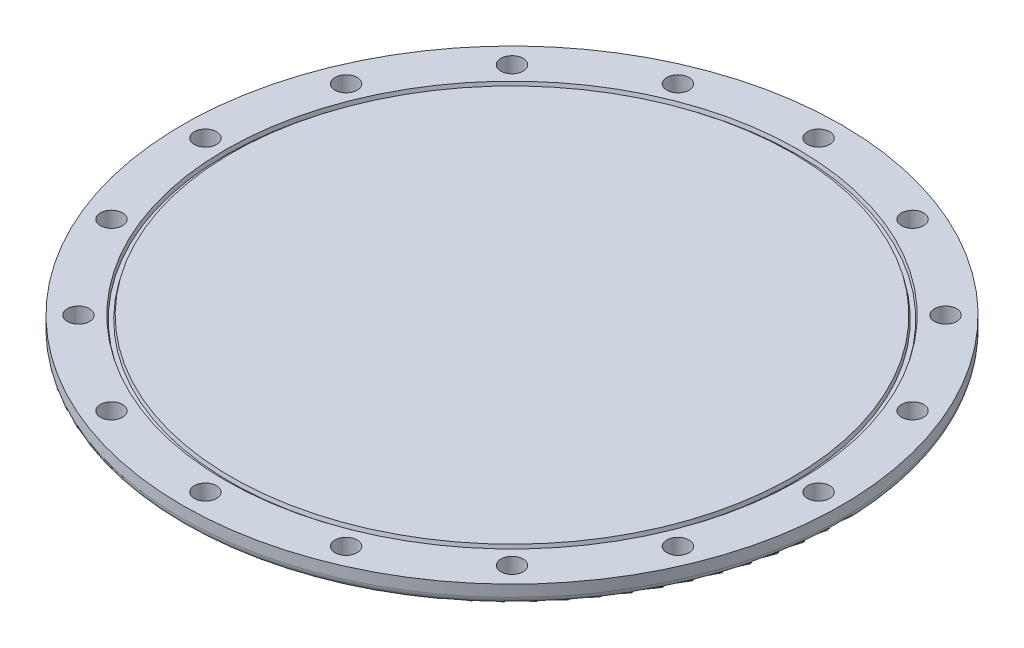
from build123d import *

# Parameters (mm, degrees)
SKETCH1_R           = 86
BOSS_EXTRUDE1_DEPTH = 5
CUT_EXTRUDE1_REACH  = 123.725
SKETCH2_R           = 2.9
FILLET1_R           = 2


with BuildPart() as part:
    # Sketch1 → Boss-Extrude1 (new body)
    with BuildSketch(Plane(origin=(0, 0, 0), x_dir=(1, 0, 0), z_dir=(0, 1, 0))):
        Circle(SKETCH1_R)
    extrude(amount=BOSS_EXTRUDE1_DEPTH)

    # Sketch2 → Cut-Extrude1 (cut, up to next)
    with BuildSketch(Plane(origin=(0, 5, 0), x_dir=(1, 0, 0), z_dir=(0, 1, 0)), mode=Mode.PRIVATE) as cut_extrude1_sk1:
        with Locations((0, 80)):
            Circle(SKETCH2_R)
    cut_extrude1_tool1 = extrude(cut_extrude1_sk1.sketch, amount=-CUT_EXTRUDE1_REACH, mode=Mode.PRIVATE) & part.part
    # Sketch2 → Cut-Extrude1 (cut, up to next)
    with BuildSketch(Plane(origin=(0, 5, 0), x_dir=(1, 0, 0), z_dir=(0, 1, 0)), mode=Mode.PRIVATE) as cut_extrude1_sk2:
        with Locations((30.614674589, 73.910362601)):
            Circle(SKETCH2_R)
    cut_extrude1_tool2 = extrude(cut_extrude1_sk2.sketch, amount=-CUT_EXTRUDE1_REACH, mode=Mode.PRIVATE) & part.part
    # Sketch2 → Cut-Extrude1 (cut, up to next)
    with BuildSketch(Plane(origin=(0, 5, 0), x_dir=(1, 0, 0), z_dir=(0, 1, 0)), mode=Mode.PRIVATE) as cut_extrude1_sk3:
        with Locations((56.568542495, 56.568542495)):
            Circle(SKETCH2_R)
    cut_extrude1_tool3 = extrude(cut_extrude1_sk3.sketch, amount=-CUT_EXTRUDE1_REACH, mode=Mode.PRIVATE) & part.part
    # Sketch2 → Cut-Extrude1 (cut, up to next)
    with BuildSketch(Plane(origin=(0, 5, 0), x_dir=(1, 0, 0), z_dir=(0, 1, 0)), mode=Mode.PRIVATE) as cut_extrude1_sk4:
        with Locations((73.910362601, 30.614674589)):
            Circle(SKETCH2_R)
    cut_extrude1_tool4 = extrude(cut_extrude1_sk4.sketch, amount=-CUT_EXTRUDE1_REACH, mode=Mode.PRIVATE) & part.part
    # Sketch2 → Cut-Extrude1 (cut, up to next)
    with BuildSketch(Plane(origin=(0, 5, 0), x_dir=(1, 0, 0), z_dir=(0, 1, 0)), mode=Mode.PRIVATE) as cut_extrude1_sk5:
        with Locations((80, 0)):
            Circle(SKETCH2_R)
    cut_extrude1_tool5 = extrude(cut_extrude1_sk5.sketch, amount=-CUT_EXTRUDE1_REACH, mode=Mode.PRIVATE) & part.part
    # Sketch2 → Cut-Extrude1 (cut, up to next)
    with BuildSketch(Plane(origin=(0, 5, 0), x_dir=(1, 0, 0), z_dir=(0, 1, 0)), mode=Mode.PRIVATE) as cut_extrude1_sk6:
        with Locations((73.910362601, -30.614674589)):
            Circle(SKETCH2_R)
    cut_extrude1_tool6 = extrude(cut_extrude1_sk6.sketch, amount=-CUT_EXTRUDE1_REACH, mode=Mode.PRIVATE) & part.part
    # Sketch2 → Cut-Extrude1 (cut, up to next)
    with BuildSketch(Plane(origin=(0, 5, 0), x_dir=(1, 0, 0), z_dir=(0, 1, 0)), mode=Mode.PRIVATE) as cut_extrude1_sk7:
        with Locations((56.568542495, -56.568542495)):
            Circle(SKETCH2_R)
    cut_extrude1_tool7 = extrude(cut_extrude1_sk7.sketch, amount=-CUT_EXTRUDE1_REACH, mode=Mode.PRIVATE) & part.part
    # Sketch2 → Cut-Extrude1 (cut, up to next)
    with BuildSketch(Plane(origin=(0, 5, 0), x_dir=(1, 0, 0), z_dir=(0, 1, 0)), mode=Mode.PRIVATE) as cut_extrude1_sk8:
        with Locations((30.614674589, -73.910362601)):
            Circle(SKETCH2_R)
    cut_extrude1_tool8 = extrude(cut_extrude1_sk8.sketch, amount=-CUT_EXTRUDE1_REACH, mode=Mode.PRIVATE) & part.part
    # Sketch2 → Cut-Extrude1 (cut, up to next)
    with BuildSketch(Plane(origin=(0, 5, 0), x_dir=(1, 0, 0), z_dir=(0, 1, 0)), mode=Mode.PRIVATE) as cut_extrude1_sk9:
        with Locations((0, -80)):
            Circle(SKETCH2_R)
    cut_extrude1_tool9 = extrude(cut_extrude1_sk9.sketch, amount=-CUT_EXTRUDE1_REACH, mode=Mode.PRIVATE) & part.part
    # Sketch2 → Cut-Extrude1 (cut, up to next)
    with BuildSketch(Plane(origin=(0, 5, 0), x_dir=(1, 0, 0), z_dir=(0, 1, 0)), mode=Mode.PRIVATE) as cut_extrude1_sk10:
        with Locations((-30.614674589, -73.910362601)):
            Circle(SKETCH2_R)
    cut_extrude1_tool10 = extrude(cut_extrude1_sk10.sketch, amount=-CUT_EXTRUDE1_REACH, mode=Mode.PRIVATE) & part.part
    # Sketch2 → Cut-Extrude1 (cut, up to next)
    with BuildSketch(Plane(origin=(0, 5, 0), x_dir=(1, 0, 0), z_dir=(0, 1, 0)), mode=Mode.PRIVATE) as cut_extrude1_sk11:
        with Locations((-56.568542495, -56.568542495)):
            Circle(SKETCH2_R)
    cut_extrude1_tool11 = extrude(cut_extrude1_sk11.sketch, amount=-CUT_EXTRUDE1_REACH, mode=Mode.PRIVATE) & part.part
    # Sketch2 → Cut-Extrude1 (cut, up to next)
    with BuildSketch(Plane(origin=(0, 5, 0), x_dir=(1, 0, 0), z_dir=(0, 1, 0)), mode=Mode.PRIVATE) as cut_extrude1_sk12:
        with Locations((-73.910362601, -30.614674589)):
            Circle(SKETCH2_R)
    cut_extrude1_tool12 = extrude(cut_extrude1_sk12.sketch, amount=-CUT_EXTRUDE1_REACH, mode=Mode.PRIVATE) & part.part
    # Sketch2 → Cut-Extrude1 (cut, up to next)
    with BuildSketch(Plane(origin=(0, 5, 0), x_dir=(1, 0, 0), z_dir=(0, 1, 0)), mode=Mode.PRIVATE) as cut_extrude1_sk13:
        with Locations((-80, 0)):
            Circle(SKETCH2_R)
    cut_extrude1_tool13 = extrude(cut_extrude1_sk13.sketch, amount=-CUT_EXTRUDE1_REACH, mode=Mode.PRIVATE) & part.part
    # Sketch2 → Cut-Extrude1 (cut, up to next)
    with BuildSketch(Plane(origin=(0, 5, 0), x_dir=(1, 0, 0), z_dir=(0, 1, 0)), mode=Mode.PRIVATE) as cut_extrude1_sk14:
        with Locations((-73.910362601, 30.614674589)):
            Circle(SKETCH2_R)
    cut_extrude1_tool14 = extrude(cut_extrude1_sk14.sketch, amount=-CUT_EXTRUDE1_REACH, mode=Mode.PRIVATE) & part.part
    # Sketch2 → Cut-Extrude1 (cut, up to next)
    with BuildSketch(Plane(origin=(0, 5, 0), x_dir=(1, 0, 0), z_dir=(0, 1, 0)), mode=Mode.PRIVATE) as cut_extrude1_sk15:
        with Locations((-56.568542495, 56.568542495)):
            Circle(SKETCH2_R)
    cut_extrude1_tool15 = extrude(cut_extrude1_sk15.sketch, amount=-CUT_EXTRUDE1_REACH, mode=Mode.PRIVATE) & part.part
    # Sketch2 → Cut-Extrude1 (cut, up to next)
    with BuildSketch(Plane(origin=(0, 5, 0), x_dir=(1, 0, 0), z_dir=(0, 1, 0)), mode=Mode.PRIVATE) as cut_extrude1_sk16:
        with Locations((-30.614674589, 73.910362601)):
            Circle(SKETCH2_R)
    cut_extrude1_tool16 = extrude(cut_extrude1_sk16.sketch, amount=-CUT_EXTRUDE1_REACH, mode=Mode.PRIVATE) & part.part
    add(cut_extrude1_tool1.solids().sort_by_distance((0, 5, -80))[0], mode=Mode.SUBTRACT)
    add(cut_extrude1_tool2.solids().sort_by_distance((30.614675, 5, -73.910363))[0], mode=Mode.SUBTRACT)
    add(cut_extrude1_tool3.solids().sort_by_distance((56.568542, 5, -56.568542))[0], mode=Mode.SUBTRACT)
    add(cut_extrude1_tool4.solids().sort_by_distance((73.910363, 5, -30.614675))[0], mode=Mode.SUBTRACT)
    add(cut_extrude1_tool5.solids().sort_by_distance((80, 5, 0))[0], mode=Mode.SUBTRACT)
    add(cut_extrude1_tool6.solids().sort_by_distance((73.910363, 5, 30.614675))[0], mode=Mode.SUBTRACT)
    add(cut_extrude1_tool7.solids().sort_by_distance((56.568542, 5, 56.568542))[0], mode=Mode.SUBTRACT)
    add(cut_extrude1_tool8.solids().sort_by_distance((30.614675, 5, 73.910363))[0], mode=Mode.SUBTRACT)
    add(cut_extrude1_tool9.solids().sort_by_distance((0, 5, 80))[0], mode=Mode.SUBTRACT)
    add(cut_extrude1_tool10.solids().sort_by_distance((-30.614675, 5, 73.910363))[0], mode=Mode.SUBTRACT)
    add(cut_extrude1_tool11.solids().sort_by_distance((-56.568542, 5, 56.568542))[0], mode=Mode.SUBTRACT)
    add(cut_extrude1_tool12.solids().sort_by_distance((-73.910363, 5, 30.614675))[0], mode=Mode.SUBTRACT)
    add(cut_extrude1_tool13.solids().sort_by_distance((-80, 5, 0))[0], mode=Mode.SUBTRACT)
    add(cut_extrude1_tool14.solids().sort_by_distance((-73.910363, 5, -30.614675))[0], mode=Mode.SUBTRACT)
    add(cut_extrude1_tool15.solids().sort_by_distance((-56.568542, 5, -56.568542))[0], mode=Mode.SUBTRACT)
    add(cut_extrude1_tool16.solids().sort_by_distance((-30.614675, 5, -73.910363))[0], mode=Mode.SUBTRACT)

    # Sketch4 → Cut-Revolve1 (revolve, cut)
    with BuildSketch(Plane.XY):
        Polygon((74, 4), (74.5, 4), (74.767949192, 5), (73.232050808, 5), (73.5, 4), align=None)
    revolve(axis=Axis((0, 0, 0), (0, 1, 0)), mode=Mode.SUBTRACT)

    # Fillet1
    fillet1_edges = [part.edges().sort_by_distance(p)[0] for p in [
        (-86, 0, 0),
    ]]
    fillet(fillet1_edges, radius=FILLET1_R)


solid = part.part
